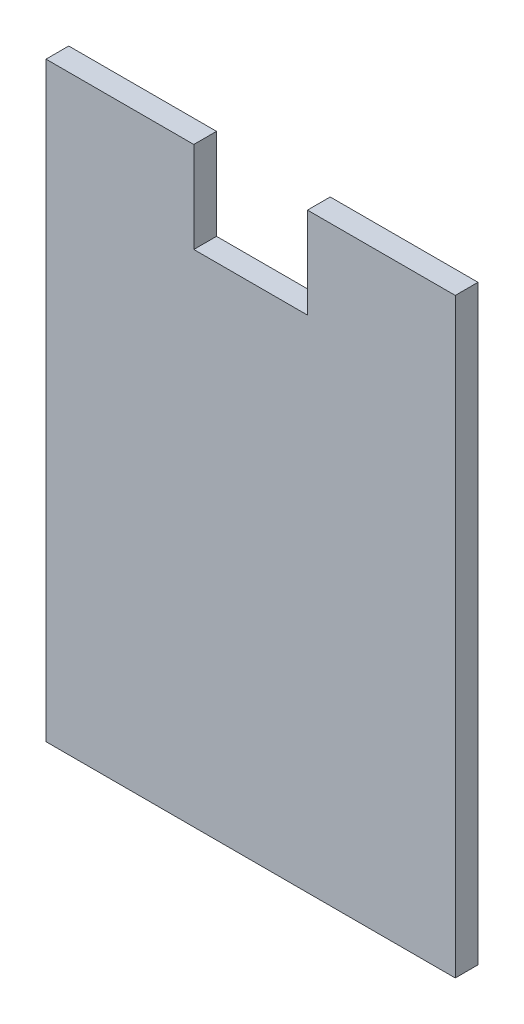
from build123d import *

# Parameters (mm, degrees)
BOSS_EXTRUDE1_DEPTH = 6.35


with BuildPart() as part:
    # Sketch1 → Boss-Extrude1 (new, symmetric)
    with BuildSketch(Plane.XY):
        Polygon((114.3, -165.1), (-114.3, -165.1), (-114.3, 165.1), (-31.75, 165.1), (-31.75, 114.3), (31.75, 114.3), (31.75, 165.1), (114.3, 165.1), align=None)
    extrude(amount=BOSS_EXTRUDE1_DEPTH, both=True)


solid = part.part
